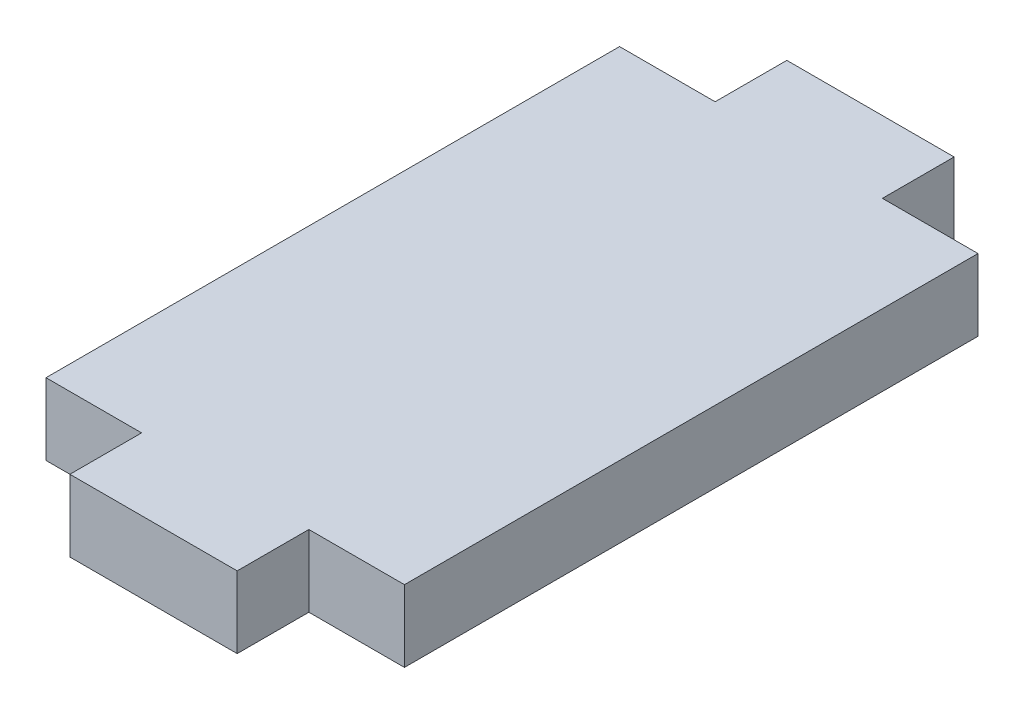
from build123d import *

# Parameters (mm, degrees)
SALIENTE_EXTRUIR1_DEPTH = 3


with BuildPart() as part:
    # Croquis1 → Saliente-Extruir1 (new body)
    with BuildSketch(Plane(origin=(0, 0, 0), x_dir=(1, 0, 0), z_dir=(0, 1, 0))):
        Polygon((0, 0), (4, 0), (4, -3), (11, -3), (11, 0), (15, 0), (15, 24), (11, 24), (11, 27), (4, 27), (4, 24), (0, 24), align=None)
    extrude(amount=SALIENTE_EXTRUIR1_DEPTH)


solid = part.part
